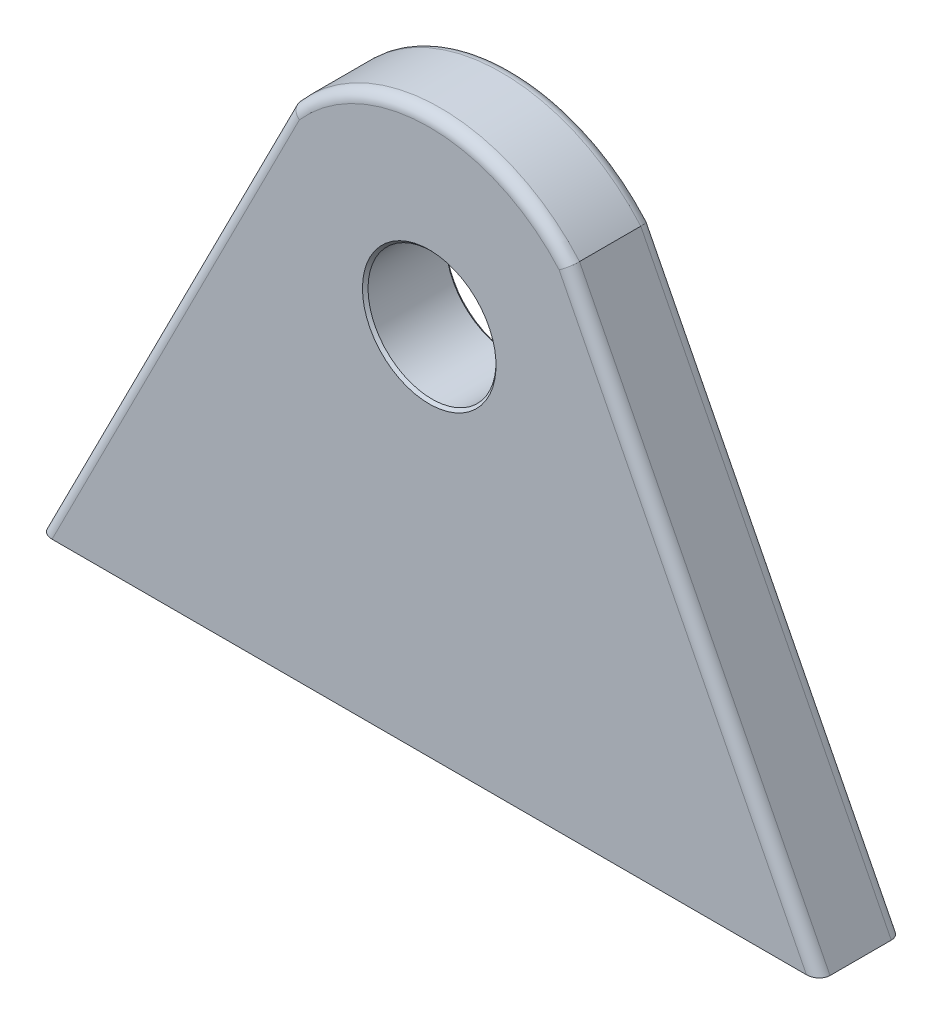
from build123d import *

# Parameters (mm, degrees)
SKETCH1_R           = 11.5
BOSS_EXTRUDE1_DEPTH = 7.5
FILLET1_R           = 2
CHAMFER1_SIZE       = 0.5


with BuildPart() as part:
    # Sketch1 → Boss-Extrude1 (new, symmetric)
    with BuildSketch(Plane.XY):
        with BuildLine():
            Line((-70, 0), (70, 0))
            Line((70, 0), (25, 88.582893039))
            ThreePointArc((25, 88.582893039), (0, 100), (-25, 88.582893039))
            Line((-25, 88.582893039), (-70, 0))
        make_face()
        with Locations((0, 66.920239342)):
            Circle(SKETCH1_R, mode=Mode.SUBTRACT)
    extrude(amount=BOSS_EXTRUDE1_DEPTH, both=True)

    # Fillet1
    # the kernel refuses this fillet: 2 mm, written as the material it takes off along each edge
    with BuildSketch(Plane(origin=(72.264547882, -4.457782284, 7.5), x_dir=(0, 0, -1), z_dir=(-0.45290957632946743, 0.8915564568040896, 0)), Plane(origin=(-22.735452118, 93.040675323, 7.5), x_dir=(0, 0, -1), z_dir=(-0.45290957632946743, -0.8915564568040896, 0))) as fillet1_piece_1:
        with BuildLine():
            CenterArc((FILLET1_R, FILLET1_R), FILLET1_R, 180, 90)
            Line((0, FILLET1_R), (0, 0))
            Line((0, 0), (FILLET1_R, 0))
        make_face()
    extrude(amount=109.357581186, mode=Mode.SUBTRACT)
    with BuildSketch(Plane(origin=(0, 66.920239342, 7.5), x_dir=(0.8457767754384001, 0.5335369210551618, 0), z_dir=(0.5335369210551618, -0.8457767754384001, 0))) as fillet1_piece_2:
        with BuildLine():
            CenterArc((33.079760658 - FILLET1_R, -FILLET1_R), FILLET1_R, 0, 90)
            Line((33.079760658 - FILLET1_R, 0), (33.079760658, 0))
            Line((33.079760658, 0), (33.079760658, -FILLET1_R))
        make_face()
    revolve(axis=Axis((0, 66.920239342, 7.5), (0, 0, 1)), revolution_arc=115.510513381, mode=Mode.SUBTRACT)
    with BuildSketch(Plane(origin=(0, 66.920239342, -7.5), x_dir=(0.8457767754384001, 0.5335369210551618, 0), z_dir=(0.5335369210551618, -0.8457767754384001, 0))) as fillet1_piece_3:
        with BuildLine():
            CenterArc((33.079760658 - FILLET1_R, FILLET1_R), FILLET1_R, 270, 90)
            Line((33.079760658 - FILLET1_R, 0), (33.079760658, 0))
            Line((33.079760658, 0), (33.079760658, FILLET1_R))
        make_face()
    revolve(axis=Axis((0, 66.920239342, -7.5), (0, 0, 1)), revolution_arc=115.510513381, mode=Mode.SUBTRACT)
    with BuildSketch(Plane(origin=(72.264547882, -4.457782284, -7.5), x_dir=(0, 0, 1), z_dir=(-0.45290957632946743, 0.8915564568040896, 0)), Plane(origin=(-22.735452118, 93.040675323, -7.5), x_dir=(0, 0, 1), z_dir=(-0.45290957632946743, -0.8915564568040896, 0))) as fillet1_piece_4:
        with BuildLine():
            CenterArc((FILLET1_R, -FILLET1_R), FILLET1_R, 90, 90)
            Line((0, -FILLET1_R), (0, 0))
            Line((0, 0), (FILLET1_R, 0))
        make_face()
    extrude(amount=109.357581186, mode=Mode.SUBTRACT)

    # Chamfer1
    chamfer1_edges = [part.edges().sort_by_distance(p)[0] for p in [
        (-11.5, 66.920239342, -7.5),
        (-11.5, 66.920239342, 7.5),
    ]]
    chamfer(chamfer1_edges, length=CHAMFER1_SIZE)


solid = part.part
